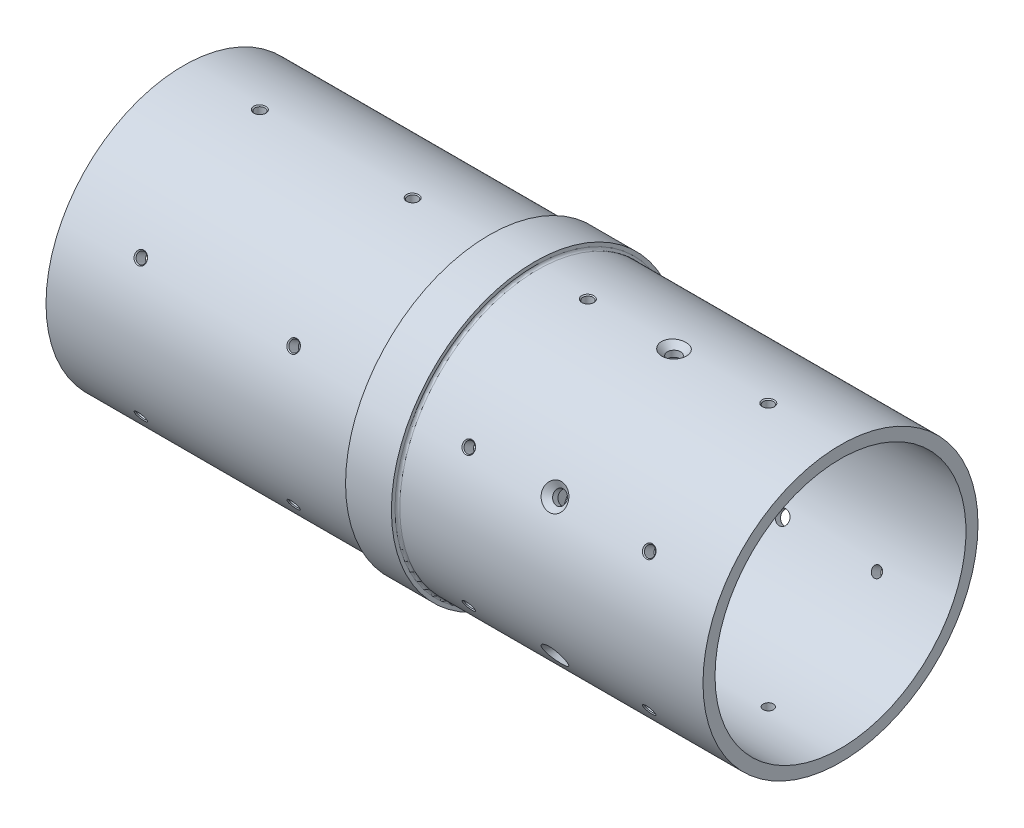
from build123d import *

# Parameters (mm, degrees)
CIRPATTERN1_COUNT              = 6
M5X0_8_TAPPED_HOLE1_AT_2_COUNT = 2
M5X0_8_TAPPED_HOLE1_AT_2_PITCH = 75
CIRPATTERN2_COUNT              = 6
M5X0_8_TAPPED_HOLE2_AT_2_COUNT = 2
M5X0_8_TAPPED_HOLE2_AT_2_PITCH = 63.5
CIRPATTERN3_COUNT              = 6


with BuildPart() as part:
    # Sketch1 → Revolve1 (revolve)
    with BuildSketch(Plane(origin=(0, 0, 0), x_dir=(1, 0, 0), z_dir=(0, 1, 0))):
        with BuildLine():
            Line((-95.7, 42.15), (-105.7, 52.15))
            Line((-105.7, 52.15), (-273.05, 52.15))
            Line((-273.05, 52.15), (-273.05, 57.15))
            Line((-273.05, 57.15), (-147.05, 57.15))
            ThreePointArc((-147.05, 57.15), (-146.342893219, 57.442893219), (-146.05, 58.15))
            Line((-146.05, 58.15), (-146.05, 59.65))
            Line((-146.05, 59.65), (-127, 59.65))
            Line((-127, 59.65), (-127, 58.15))
            ThreePointArc((-127, 58.15), (-126.707106781, 57.442893219), (-126, 57.15))
            Line((-126, 57.15), (0, 57.15))
            Line((0, 57.15), (0, 52.15))
            Line((0, 52.15), (-74.2, 52.15))
            ThreePointArc((-74.2, 52.15), (-75.614213562, 51.564213562), (-76.2, 50.15))
            Line((-76.2, 50.15), (-76.2, 42.15))
            Line((-76.2, 42.15), (-95.7, 42.15))
        make_face()
    revolve(axis=Axis((-185.768615225, 0, 0), (1, 0, 0)))

    # Sketch5 → CSK for M5 Flat Head Machine Screw2 (revolve, cut)
    with BuildSketch(Plane(origin=(-69.2, 57.15, 0), x_dir=(0, 0, 1), z_dir=(1, 0, 0))):
        Polygon((0, 0), (0, 13.652366702), (2.75, 12), (2.75, 2.45), (5.2, 0), align=None)
    csk_for_m5_flat_head_machine_screw2 = revolve(axis=Axis((-69.2, 63.5, 0), (0, -1, 0)), mode=Mode.SUBTRACT)

    # CirPattern1: CSK for M5 Flat Head Machine Screw2 ×6 about axis
    cirpattern1_axis = Axis((0, 0, 0), (-1, 0, 0))
    for i in range(1, CIRPATTERN1_COUNT):
        add(csk_for_m5_flat_head_machine_screw2.rotate(cirpattern1_axis, i * 360 / CIRPATTERN1_COUNT), mode=Mode.SUBTRACT)

    # Sketch8 → M5x0.8 Tapped Hole1 (revolve, cut)
    with BuildSketch(Plane(origin=(-30, 57.15, 0), x_dir=(0, 0, 1), z_dir=(1, 0, 0))):
        Polygon((0, 0), (0, 9.2618073), (2.1, 8), (2.1, 0.425), (2.525, 0), align=None)
    m5x0_8_tapped_hole1 = revolve(axis=Axis((-30, 63.5, 0), (0, -1, 0)), mode=Mode.SUBTRACT)

    # M5x0.8 Tapped Hole1 at 2: M5x0.8 Tapped Hole1 ×2
    with Locations(*[(-i * M5X0_8_TAPPED_HOLE1_AT_2_PITCH, 0, 0) for i in range(1, M5X0_8_TAPPED_HOLE1_AT_2_COUNT)]):
        add(m5x0_8_tapped_hole1, mode=Mode.SUBTRACT)

    # CirPattern2: M5x0.8 Tapped Hole1 ×6 about axis
    cirpattern2_axis = Axis((0, 0, 0), (-1, 0, 0))
    for i in range(1, CIRPATTERN2_COUNT):
        add(m5x0_8_tapped_hole1.rotate(cirpattern2_axis, i * 360 / CIRPATTERN2_COUNT), mode=Mode.SUBTRACT)

    # CirPattern2 copy 1 sketch → CirPattern2 copy 1 (revolve, cut)
    with BuildSketch(Plane(origin=(-105, 28.575, -49.493351826), x_dir=(0, 0.8660254037844386, 0.5000000000000001), z_dir=(1, 0, 0))):
        Polygon((0, 0), (0, 9.2618073), (2.1, 8), (2.1, 0.425), (2.525, 0), align=None)
    revolve(axis=Axis((-105, 31.75, -54.99261314), (0, -0.5000000000000001, 0.8660254037844386)), mode=Mode.SUBTRACT)

    # CirPattern2 copy 2 sketch → CirPattern2 copy 2 (revolve, cut)
    with BuildSketch(Plane(origin=(-105, -28.575, -49.493351826), x_dir=(0, 0.8660254037844387, -0.4999999999999998), z_dir=(1, 0, 0))):
        Polygon((0, 0), (0, 9.2618073), (2.1, 8), (2.1, 0.425), (2.525, 0), align=None)
    revolve(axis=Axis((-105, -31.75, -54.99261314), (0, 0.4999999999999998, 0.8660254037844387)), mode=Mode.SUBTRACT)

    # CirPattern2 copy 3 sketch → CirPattern2 copy 3 (revolve, cut)
    with BuildSketch(Plane(origin=(-105, -57.15, 0), x_dir=(0, 0, -1), z_dir=(1, 0, 0))):
        Polygon((0, 0), (0, 9.2618073), (2.1, 8), (2.1, 0.425), (2.525, 0), align=None)
    revolve(axis=Axis((-105, -63.5, 0), (0, 1, 0)), mode=Mode.SUBTRACT)

    # CirPattern2 copy 4 sketch → CirPattern2 copy 4 (revolve, cut)
    with BuildSketch(Plane(origin=(-105, -28.575, 49.493351826), x_dir=(0, -0.8660254037844384, -0.5000000000000004), z_dir=(1, 0, 0))):
        Polygon((0, 0), (0, 9.2618073), (2.1, 8), (2.1, 0.425), (2.525, 0), align=None)
    revolve(axis=Axis((-105, -31.75, 54.99261314), (0, 0.5000000000000004, -0.8660254037844384)), mode=Mode.SUBTRACT)

    # CirPattern2 copy 5 sketch → CirPattern2 copy 5 (revolve, cut)
    with BuildSketch(Plane(origin=(-105, 28.575, 49.493351826), x_dir=(0, -0.8660254037844386, 0.5000000000000001), z_dir=(1, 0, 0))):
        Polygon((0, 0), (0, 9.2618073), (2.1, 8), (2.1, 0.425), (2.525, 0), align=None)
    revolve(axis=Axis((-105, 31.75, 54.99261314), (0, -0.5000000000000001, -0.8660254037844386)), mode=Mode.SUBTRACT)

    # Sketch10 → M5x0.8 Tapped Hole2 (revolve, cut)
    with BuildSketch(Plane(origin=(-241.3, 57.15, 0), x_dir=(0, 0, 1), z_dir=(1, 0, 0))):
        Polygon((0, 0), (0, 9.2618073), (2.1, 8), (2.1, 0.425), (2.525, 0), align=None)
    m5x0_8_tapped_hole2 = revolve(axis=Axis((-241.3, 63.5, 0), (0, -1, 0)), mode=Mode.SUBTRACT)

    # M5x0.8 Tapped Hole2 at 2: M5x0.8 Tapped Hole2 ×2
    with Locations(*[(i * M5X0_8_TAPPED_HOLE2_AT_2_PITCH, 0, 0) for i in range(1, M5X0_8_TAPPED_HOLE2_AT_2_COUNT)]):
        add(m5x0_8_tapped_hole2, mode=Mode.SUBTRACT)

    # CirPattern3: M5x0.8 Tapped Hole2 ×6 about axis
    cirpattern3_axis = Axis((0, 0, 0), (-1, 0, 0))
    for i in range(1, CIRPATTERN3_COUNT):
        add(m5x0_8_tapped_hole2.rotate(cirpattern3_axis, i * 360 / CIRPATTERN3_COUNT), mode=Mode.SUBTRACT)

    # CirPattern3 copy 1 sketch → CirPattern3 copy 1 (revolve, cut)
    with BuildSketch(Plane(origin=(-177.8, 28.575, -49.493351826), x_dir=(0, 0.8660254037844386, 0.5000000000000001), z_dir=(1, 0, 0))):
        Polygon((0, 0), (0, 9.2618073), (2.1, 8), (2.1, 0.425), (2.525, 0), align=None)
    revolve(axis=Axis((-177.8, 31.75, -54.99261314), (0, -0.5000000000000001, 0.8660254037844386)), mode=Mode.SUBTRACT)

    # CirPattern3 copy 2 sketch → CirPattern3 copy 2 (revolve, cut)
    with BuildSketch(Plane(origin=(-177.8, -28.575, -49.493351826), x_dir=(0, 0.8660254037844387, -0.4999999999999998), z_dir=(1, 0, 0))):
        Polygon((0, 0), (0, 9.2618073), (2.1, 8), (2.1, 0.425), (2.525, 0), align=None)
    revolve(axis=Axis((-177.8, -31.75, -54.99261314), (0, 0.4999999999999998, 0.8660254037844387)), mode=Mode.SUBTRACT)

    # CirPattern3 copy 3 sketch → CirPattern3 copy 3 (revolve, cut)
    with BuildSketch(Plane(origin=(-177.8, -57.15, 0), x_dir=(0, 0, -1), z_dir=(1, 0, 0))):
        Polygon((0, 0), (0, 9.2618073), (2.1, 8), (2.1, 0.425), (2.525, 0), align=None)
    revolve(axis=Axis((-177.8, -63.5, 0), (0, 1, 0)), mode=Mode.SUBTRACT)

    # CirPattern3 copy 4 sketch → CirPattern3 copy 4 (revolve, cut)
    with BuildSketch(Plane(origin=(-177.8, -28.575, 49.493351826), x_dir=(0, -0.8660254037844384, -0.5000000000000004), z_dir=(1, 0, 0))):
        Polygon((0, 0), (0, 9.2618073), (2.1, 8), (2.1, 0.425), (2.525, 0), align=None)
    revolve(axis=Axis((-177.8, -31.75, 54.99261314), (0, 0.5000000000000004, -0.8660254037844384)), mode=Mode.SUBTRACT)

    # CirPattern3 copy 5 sketch → CirPattern3 copy 5 (revolve, cut)
    with BuildSketch(Plane(origin=(-177.8, 28.575, 49.493351826), x_dir=(0, -0.8660254037844386, 0.5000000000000001), z_dir=(1, 0, 0))):
        Polygon((0, 0), (0, 9.2618073), (2.1, 8), (2.1, 0.425), (2.525, 0), align=None)
    revolve(axis=Axis((-177.8, 31.75, 54.99261314), (0, -0.5000000000000001, -0.8660254037844386)), mode=Mode.SUBTRACT)


solid = part.part
